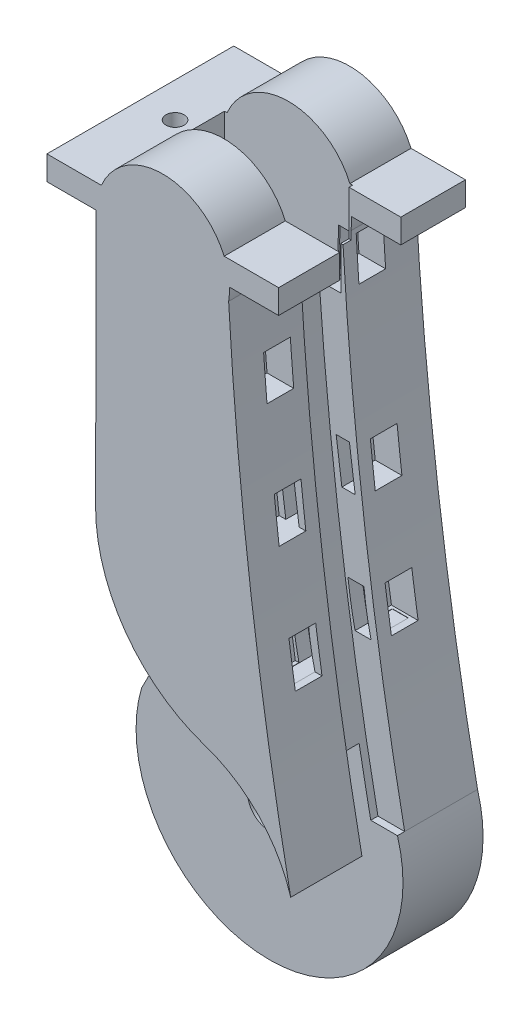
from build123d import *

# Parameters (mm, degrees)
CROQUIS2_R                  = 4.1
SALIENTE_EXTRUIR1_DEPTH     = 35
CROQUIS3_W                  = 24
CROQUIS3_H                  = 12.1
CORTAR_EXTRUIR1_DEPTH       = 24
CROQUIS9_R                  = 1.7
CORTAR_EXTRUIR2_DEPTH       = 10
CORTAR_EXTRUIR3_START       = -10
CROQUIS11_R                 = 25
CORTAR_EXTRUIR3_DEPTH       = 10
CORTAR_EXTRUIR5_START       = 13.655231177
CORTAR_EXTRUIR5_DEPTH       = 8
CORTAR_EXTRUIR5_START_2     = 6.155231177
CORTAR_EXTRUIR5_2_DEPTH     = 5
CORTAR_EXTRUIR5_START_3     = 24.155231177
CORTAR_EXTRUIR5_3_DEPTH     = 5
CORTAR_EXTRUIR6_START       = -10
CROQUIS13_R                 = 25
CORTAR_EXTRUIR6_DEPTH       = 10
CROQUIS14_R                 = 11.035
CORTAR_EXTRUIR7_DEPTH       = 8.05
CORTAR_EXTRUIR8_DEPTH       = 15
CORTAR_EXTRUIR8_DEPTH_BACK  = 7
CORTAR_EXTRUIR9_DEPTH       = 15
CORTAR_EXTRUIR9_DEPTH_BACK  = 7
CORTAR_EXTRUIR10_DEPTH      = 15
CORTAR_EXTRUIR10_DEPTH_BACK = 7
CORTAR_EXTRUIR11_DEPTH      = 121.441894704
REDONDEO1_R                 = 30
CROQUIS22_W                 = 11.434183309
CROQUIS22_H                 = 8.348024574
CORTAR_EXTRUIR12_DEPTH      = 10


# Read off the part's stored shape, not the designer's step: Cortar-Extruir5
with BuildPart() as part:
    # Croquis2 → Saliente-Extruir1 (new body)
    with BuildSketch(Plane.XY):
        with BuildLine():
            Line((-11.5, 104.898979486), (-21.7, 104.898979486))
            Line((-21.7, 104.898979486), (-21.7, 100.380604651))
            Line((-21.7, 100.380604651), (-12.49420426, 100.380604651))
            ThreePointArc((-12.49420426, 100.380604651), (-12.498149406, 99.784915281), (-12.473709842, 99.189714392))
            ThreePointArc((-12.473709842, 99.189714392), (-16.573234399, 52.954310766), (-23.961892015, 7.129356989))
            ThreePointArc((-23.961892015, 7.129356989), (0, -25), (23.961892015, 7.129356989))
            ThreePointArc((23.961892015, 7.129356989), (16.547311175, 52.357383104), (12.33822575, 97.995458822))
            ThreePointArc((12.33822575, 97.995458822), (12.473356614, 99.184294915), (12.49420426, 100.380604651))
            Line((12.49420426, 100.380604651), (21.7, 100.380604651))
            Line((21.7, 100.380604651), (21.7, 104.898979486))
            Line((21.7, 104.898979486), (11.5, 104.898979486))
            ThreePointArc((11.5, 104.898979486), (0, 112.5), (-11.5, 104.898979486))
        make_face()
        Circle(CROQUIS2_R, mode=Mode.SUBTRACT)
    extrude(amount=SALIENTE_EXTRUIR1_DEPTH)

    # Croquis3 → Cortar-Extruir1 (cut)
    with BuildSketch(Plane(origin=(0, 112.5, 0), x_dir=(1, 0, 0), z_dir=(0, 1, 0))):
        with Locations((0, -17.5)):
            Rectangle(CROQUIS3_W, CROQUIS3_H)
    extrude(amount=-CORTAR_EXTRUIR1_DEPTH, mode=Mode.SUBTRACT)

    # Croquis9 → Cortar-Extruir2 (cut)
    with BuildSketch(Plane(origin=(0, 104.898979486, 0), x_dir=(1, 0, 0), z_dir=(0, 1, 0))):
        with Locations(Location((-15.2, -17.5, 0), (0, 0, 270))):
            Circle(CROQUIS9_R)
        with Locations(Location((15.2, -17.5, 0), (0, 0, 270))):
            Circle(CROQUIS9_R)
    extrude(amount=-CORTAR_EXTRUIR2_DEPTH, mode=Mode.SUBTRACT)

    # Croquis11 → Cortar-Extruir3 (cut)
    with BuildSketch(Plane.XY.offset(35).offset(CORTAR_EXTRUIR3_START)):
        Circle(CROQUIS11_R)
    extrude(amount=CORTAR_EXTRUIR3_DEPTH, mode=Mode.SUBTRACT)

    # Cortar-Extruir5 outline → Cortar-Extruir5 (cut)
    with BuildSketch(Plane.XY.offset(CORTAR_EXTRUIR5_START)):
        with BuildLine():
            Line((12.387970466, 97.129356989), (12, 97.129356989))
            Line((12, 97.129356989), (12, 88.5))
            Line((12, 88.5), (7.946995801, 88.5))
            ThreePointArc((7.946995801, 88.5), (12.16824242, 47.640569315), (18.961892015, 7.129356989))
            Line((18.961892015, 7.129356989), (23.961892015, 7.129356989))
            ThreePointArc((23.961892015, 7.129356989), (16.602493766, 51.9271429), (12.387970466, 97.129356989))
        make_face()
    extrude(amount=CORTAR_EXTRUIR5_DEPTH, mode=Mode.SUBTRACT)

    # Cortar-Extruir5 2 outline → Cortar-Extruir5 2 (cut)
    with BuildSketch(Plane.XY.offset(CORTAR_EXTRUIR5_START_2)):
        with BuildLine():
            ThreePointArc((12.902326037, 89.129356989), (12.63281503, 93.128564031), (12.387970466, 97.129356989))
            Line((12.387970466, 97.129356989), (7.387970466, 97.129356989))
            ThreePointArc((7.387970466, 97.129356989), (7.63281503, 93.128564031), (7.902326037, 89.129356989))
            Line((7.902326037, 89.129356989), (12.902326037, 89.129356989))
        make_face()
        with BuildLine():
            ThreePointArc((15.954808066, 57.129356989), (15.485901101, 61.127943182), (15.041769556, 65.129356989))
            Line((15.041769556, 65.129356989), (10.041769556, 65.129356989))
            ThreePointArc((10.041769556, 65.129356989), (10.485901101, 61.127943182), (10.954808066, 57.129356989))
            Line((10.954808066, 57.129356989), (15.954808066, 57.129356989))
        make_face()
        with BuildLine():
            ThreePointArc((18.985918027, 35.129356989), (18.378022509, 39.127504621), (17.795013863, 43.129356989))
            Line((17.795013863, 43.129356989), (12.795013863, 43.129356989))
            ThreePointArc((12.795013863, 43.129356989), (13.378022509, 39.127504621), (13.985918027, 35.129356989))
            Line((13.985918027, 35.129356989), (18.985918027, 35.129356989))
        make_face()
    extrude(amount=CORTAR_EXTRUIR5_2_DEPTH, mode=Mode.SUBTRACT)

    # Cortar-Extruir5 3 outline → Cortar-Extruir5 3 (cut)
    with BuildSketch(Plane.XY.offset(CORTAR_EXTRUIR5_START_3)):
        with BuildLine():
            ThreePointArc((13.684802762, 79.129356989), (13.35325681, 83.128371707), (13.046404729, 87.129356989))
            Line((13.046404729, 87.129356989), (8.046404729, 87.129356989))
            ThreePointArc((8.046404729, 87.129356989), (8.35325681, 83.128371707), (8.684802762, 79.129356989))
            Line((8.684802762, 79.129356989), (13.684802762, 79.129356989))
        make_face()
        with BuildLine():
            ThreePointArc((15.954808066, 57.129356989), (15.485901101, 61.127943182), (15.041769556, 65.129356989))
            Line((15.041769556, 65.129356989), (10.041769556, 65.129356989))
            ThreePointArc((10.041769556, 65.129356989), (10.485901101, 61.127943182), (10.954808066, 57.129356989))
            Line((10.954808066, 57.129356989), (15.954808066, 57.129356989))
        make_face()
        with BuildLine():
            ThreePointArc((18.985918027, 35.129356989), (18.378022509, 39.127504621), (17.795013863, 43.129356989))
            Line((17.795013863, 43.129356989), (12.795013863, 43.129356989))
            ThreePointArc((12.795013863, 43.129356989), (13.378022509, 39.127504621), (13.985918027, 35.129356989))
            Line((13.985918027, 35.129356989), (18.985918027, 35.129356989))
        make_face()
    extrude(amount=CORTAR_EXTRUIR5_3_DEPTH, mode=Mode.SUBTRACT)

    # Croquis13 → Cortar-Extruir6 (cut)
    with BuildSketch(Plane.XY.offset(25).offset(CORTAR_EXTRUIR6_START)):
        Circle(CROQUIS13_R)
    extrude(amount=CORTAR_EXTRUIR6_DEPTH, mode=Mode.SUBTRACT)

    # Croquis14 → Cortar-Extruir7 (cut)
    with BuildSketch(Plane(origin=(0, 0, 0), x_dir=(-1, 0, 0), z_dir=(0, 0, -1))):
        Circle(CROQUIS14_R)
    extrude(amount=-CORTAR_EXTRUIR7_DEPTH, mode=Mode.SUBTRACT)

    # Croquis16 → Cortar-Extruir8 (cut, two sides: drawn at the far end of the back side and taken through both)
    with BuildSketch(Plane(origin=(0, 0, 21.655231177), x_dir=(-1, 0, 0), z_dir=(0, 0, -1)).offset(-CORTAR_EXTRUIR8_DEPTH_BACK)):
        with BuildLine():
            Line((-13.627629456, 65.129356989), (-11.127629456, 65.129356989))
            ThreePointArc((-11.127629456, 65.129356989), (-11.671619883, 61.130083418), (-12.204820334, 57.129356989))
            Line((-12.204820334, 57.129356989), (-14.704820334, 57.129356989))
            ThreePointArc((-14.704820334, 57.129356989), (-14.1517613, 61.127409483), (-13.627629456, 65.129356989))
        make_face()
    extrude(amount=CORTAR_EXTRUIR8_DEPTH + CORTAR_EXTRUIR8_DEPTH_BACK, mode=Mode.SUBTRACT)

    # Croquis17 → Cortar-Extruir9 (cut, two sides: drawn at the far end of the back side and taken through both)
    with BuildSketch(Plane(origin=(0, 0, 21.655231177), x_dir=(-1, 0, 0), z_dir=(0, 0, -1)).offset(-CORTAR_EXTRUIR9_DEPTH_BACK)):
        with BuildLine():
            Line((-11.915557759, 97.129356989), (-9.415557759, 97.129356989))
            ThreePointArc((-9.415557759, 97.129356989), (-9.298046866, 93.126118397), (-9.554223154, 89.129356989))
            Line((-9.554223154, 89.129356989), (-12.054223154, 89.129356989))
            ThreePointArc((-12.054223154, 89.129356989), (-11.961814646, 93.128957012), (-11.915557759, 97.129356989))
        make_face()
    extrude(amount=CORTAR_EXTRUIR9_DEPTH + CORTAR_EXTRUIR9_DEPTH_BACK, mode=Mode.SUBTRACT)

    # Croquis18 → Cortar-Extruir10 (cut, two sides: drawn at the far end of the back side and taken through both)
    with BuildSketch(Plane(origin=(0, 0, 21.655231177), x_dir=(-1, 0, 0), z_dir=(0, 0, -1)).offset(-CORTAR_EXTRUIR10_DEPTH_BACK)):
        with BuildLine():
            Line((-16.345625555, 43.076723993), (-13.345625555, 43.076723993))
            ThreePointArc((-13.345625555, 43.076723993), (-13.91361536, 39.060592935), (-14.675658247, 35.076723993))
            Line((-14.675658247, 35.076723993), (-17.675658247, 35.076723993))
            ThreePointArc((-17.675658247, 35.076723993), (-16.863871756, 39.052322857), (-16.345625555, 43.076723993))
        make_face()
    extrude(amount=CORTAR_EXTRUIR10_DEPTH + CORTAR_EXTRUIR10_DEPTH_BACK, mode=Mode.SUBTRACT)

    # Croquis21 → Cortar-Extruir11 (cut, through all)
    with BuildSketch(Plane.XY.offset(35)):
        with BuildLine():
            Line((-12.473709842, 99.189714392), (-12.586604544, 52.126321873))
            ThreePointArc((-12.586604544, 52.126321873), (-15.474466118, 28.920051094), (-23.961892015, 7.129356989))
            Line((-23.961892015, 7.129356989), (-12.473709842, 99.189714392))
        make_face()
    extrude(amount=-CORTAR_EXTRUIR11_DEPTH, mode=Mode.SUBTRACT)

    # Redondeo1
    # the kernel refuses this fillet: 30 mm, written as the material it takes off along each edge
    with BuildSketch(Plane(origin=(-20.412546923, 14.433569486, 131.323871826), x_dir=(0.9503032831385696, 0.3113256655916044, 0), z_dir=(0, 0, -1))) as redondeo1_piece_1:
        with BuildLine():
            CenterArc((47.69462314, -24.085461873), REDONDEO1_R, 126.596996469, 71.521785283)
            ThreePointArc((19.182207947, -33.41510173), (11.30875316, -15.721520532), (0, 0))
            ThreePointArc((0, 0), (14.904569731, -4.928781773), (29.809139462, 0))
        make_face()
    extrude(amount=116.323871826, mode=Mode.SUBTRACT)

    # Croquis22 → Cortar-Extruir12 (cut)
    with BuildSketch(Plane(origin=(21.7, 0, 0), x_dir=(0, 0, -1), z_dir=(1, 0, 0))):
        with Locations((-17.832908346, 100.724967199)):
            Rectangle(CROQUIS22_W, CROQUIS22_H)
    extrude(amount=-CORTAR_EXTRUIR12_DEPTH, mode=Mode.SUBTRACT)


solid = part.part
